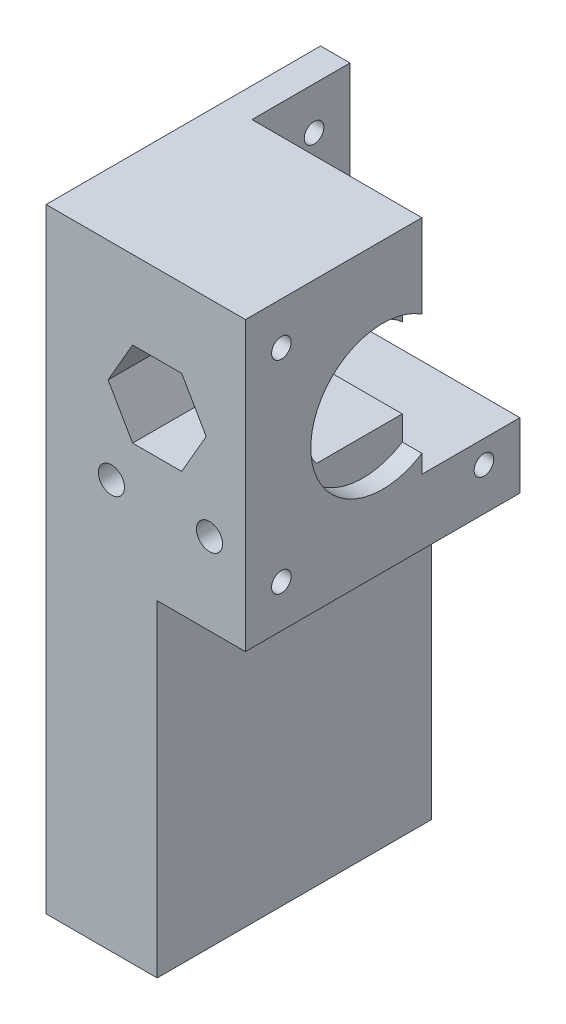
from build123d import *

# Parameters (mm, degrees)
BOSS_EXTRUDE1_DEPTH = 42
SKETCH2_R           = 1.5
SKETCH2_R_2         = 9
CUT_EXTRUDE1_DEPTH  = 73.071145405
SKETCH4_W           = 15
SKETCH4_H           = 34
CUT_EXTRUDE4_DEPTH  = 26
SKETCH5_W           = 23
SKETCH5_H           = 6.5
BOSS_EXTRUDE2_DEPTH = 20
SKETCH3_R           = 2
CUT_EXTRUDE3_DEPTH  = 42
SKETCH2_3_R         = 11
SKETCH2_3_R_2       = 9
CUT_EXTRUDE5_DEPTH  = 3


with BuildPart() as part:
    # Sketch1 → Boss-Extrude1 (new body)
    with BuildSketch(Plane.XY):
        Polygon((0, 44), (0, -50), (17, -50), (17, 0), (30.5, 0), (30.5, 44), align=None)
    extrude(amount=BOSS_EXTRUDE1_DEPTH)

    # Sketch2 → Cut-Extrude1 (cut, through all)
    with BuildSketch(Plane(origin=(30.5, 0, 0), x_dir=(0, 0, -1), z_dir=(1, 0, 0))):
        with Locations((-5.5, 37.5)):
            Circle(SKETCH2_R)
        with Locations((-36.5, 37.5)):
            Circle(SKETCH2_R)
        with Locations((-36.5, 6.5)):
            Circle(SKETCH2_R)
        with Locations((-5.5, 6.5)):
            Circle(SKETCH2_R)
        with Locations((-21, 22)):
            Circle(SKETCH2_R_2)
    extrude(amount=-CUT_EXTRUDE1_DEPTH, mode=Mode.SUBTRACT)

    # Sketch4 → Cut-Extrude4 (cut)
    with BuildSketch(Plane(origin=(30.5, 0, 0), x_dir=(0, 0, -1), z_dir=(1, 0, 0))):
        with Locations((-7.5, 27)):
            Rectangle(SKETCH4_W, SKETCH4_H)
    extrude(amount=-CUT_EXTRUDE4_DEPTH, mode=Mode.SUBTRACT)

    # Sketch5 → Boss-Extrude2 (add)
    with BuildSketch(Plane(origin=(0, 0, 15), x_dir=(-1, 0, 0), z_dir=(0, 0, -1))):
        with Locations((-16, 13.25)):
            Rectangle(SKETCH5_W, SKETCH5_H)
    extrude(amount=-BOSS_EXTRUDE2_DEPTH)

    # Sketch3 → Cut-Extrude3 (cut)
    with BuildSketch(Plane.XY.offset(42)):
        Polygon((9.488893001, 25.5), (13.241669751, 19), (20.74722325, 19), (24.5, 25.5), (20.74722325, 32), (13.241669751, 32), align=None)
        with Locations((25, 12.5)):
            Circle(SKETCH3_R)
        with Locations((10, 12.5)):
            Circle(SKETCH3_R)
    extrude(amount=-CUT_EXTRUDE3_DEPTH, mode=Mode.SUBTRACT)

    # Sketch2<3> → Cut-Extrude5 (cut)
    with BuildSketch(Plane(origin=(30.5, 0, 0), x_dir=(0, 0, -1), z_dir=(1, 0, 0))):
        with Locations((-21, 22)):
            Circle(SKETCH2_3_R)
        with Locations((-21, 22)):
            Circle(SKETCH2_3_R_2, mode=Mode.SUBTRACT)
    extrude(amount=-CUT_EXTRUDE5_DEPTH, mode=Mode.SUBTRACT)


solid = part.part
